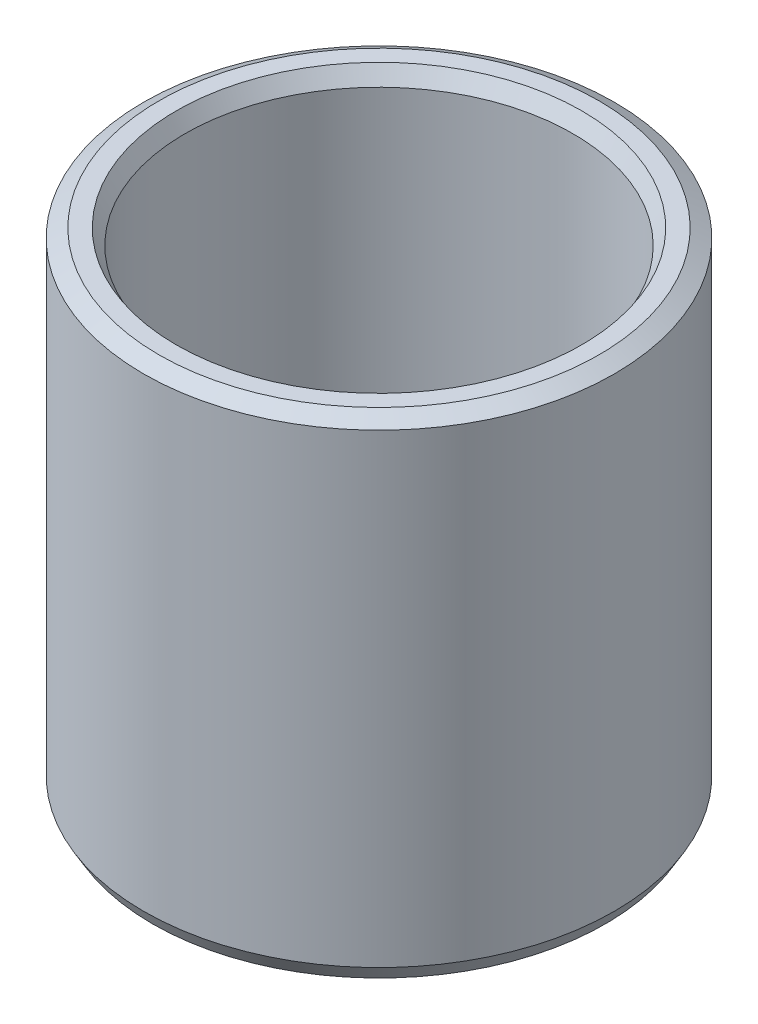
from build123d import *
from OCP.BRepFilletAPI import BRepFilletAPI_MakeChamfer

# Parameters (mm, degrees)
SKETCH1_R           = 37.5
BOSS_EXTRUDE1_DEPTH = 77.999069027
SKETCH2_R           = 30.893306858
CUT_EXTRUDE1_DEPTH  = 95.320489656
CHAMFER1_SIZE       = 1.410307298
CHAMFER1_SIZE2      = 2.442723895


with BuildPart() as part:
    # Sketch1 → Boss-Extrude1 (new body)
    with BuildSketch(Plane(origin=(0, 0, 0), x_dir=(1, 0, 0), z_dir=(0, 1, 0))):
        Circle(SKETCH1_R)
    extrude(amount=BOSS_EXTRUDE1_DEPTH)

    # Sketch2 → Cut-Extrude1 (cut, through all)
    with BuildSketch(Plane(origin=(0, 0, 0), x_dir=(1, 0, 0), z_dir=(0, 1, 0))):
        Circle(SKETCH2_R)
    extrude(amount=CUT_EXTRUDE1_DEPTH, mode=Mode.SUBTRACT)

    # Chamfer1: one chamfer whose edges measure the first distance from different faces: ONE call of the kernel's chamfer builder (chamfer() names one face for all edges)
    chamfer1_edges_1 = [part.edges().sort_by_distance(p)[0] for p in [
        (-30.893306858, 77.999069027, 0),
    ]]
    chamfer1_side_1 = [part.faces().sort_by_distance(p)[0] for p in [
        (-36.439339828, 77.999069027, 0),
    ]]
    chamfer1_edges_2 = [part.edges().sort_by_distance(p)[0] for p in [
        (-30.893306858, 0, 0),
    ]]
    chamfer1_side_2 = [part.faces().sort_by_distance(p)[0] for p in [
        (-30.893306858, 38.999534513, 0),
    ]]
    chamfer1_edges_3 = [part.edges().sort_by_distance(p)[0] for p in [
        (-37.5, 0, 0),
    ]]
    chamfer1_side_3 = [part.faces().sort_by_distance(p)[0] for p in [
        (-36.439339828, 0, 0),
    ]]
    chamfer1_edges_4 = [part.edges().sort_by_distance(p)[0] for p in [
        (-37.5, 77.999069027, 0),
    ]]
    chamfer1_side_4 = [part.faces().sort_by_distance(p)[0] for p in [
        (-37.5, 38.999534513, 0),
    ]]
    chamfer1 = BRepFilletAPI_MakeChamfer(part.part.solid().wrapped)
    for e in chamfer1_edges_1:
        chamfer1.Add(CHAMFER1_SIZE, CHAMFER1_SIZE2, e.wrapped, chamfer1_side_1[0].wrapped)  # the first distance lies on this face
    for e in chamfer1_edges_2:
        chamfer1.Add(CHAMFER1_SIZE, CHAMFER1_SIZE2, e.wrapped, chamfer1_side_2[0].wrapped)  # the first distance lies on this face
    for e in chamfer1_edges_3:
        chamfer1.Add(CHAMFER1_SIZE, CHAMFER1_SIZE2, e.wrapped, chamfer1_side_3[0].wrapped)  # the first distance lies on this face
    for e in chamfer1_edges_4:
        chamfer1.Add(CHAMFER1_SIZE, CHAMFER1_SIZE2, e.wrapped, chamfer1_side_4[0].wrapped)  # the first distance lies on this face
    add(Compound.cast(chamfer1.Shape()), mode=Mode.REPLACE)


solid = part.part
